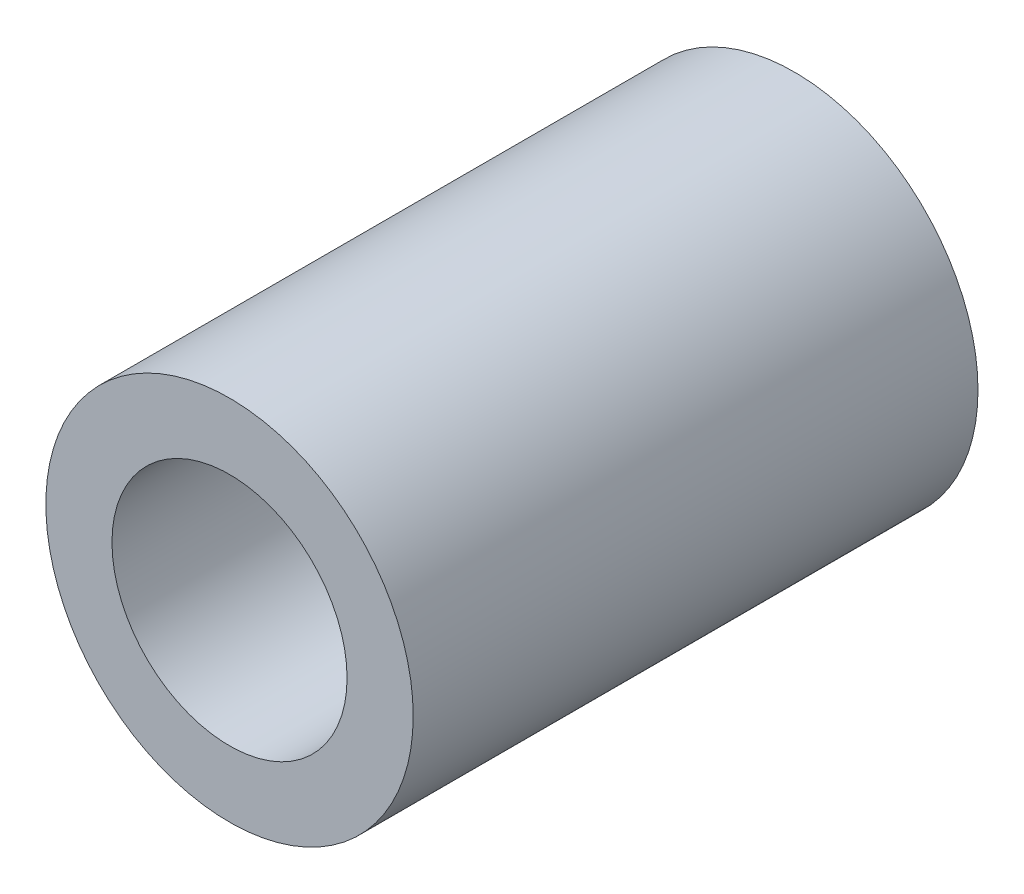
from build123d import *

# Parameters (mm, degrees)
SKETCH1_R            = 5
BOSS_EXTRUDE1_DEPTH  = 7.6875
M6_CLEARANCE_HOLE1_D = 6.4


with BuildPart() as part:
    # Sketch1 → Boss-Extrude1 (new, symmetric)
    with BuildSketch(Plane.XY):
        Circle(SKETCH1_R)
    extrude(amount=BOSS_EXTRUDE1_DEPTH, both=True)

    # M6 Clearance Hole1 (through all)
    with Locations(Plane.XY.offset(7.6875)):
        with Locations((0, 0)):
            Hole(M6_CLEARANCE_HOLE1_D / 2)


solid = part.part
